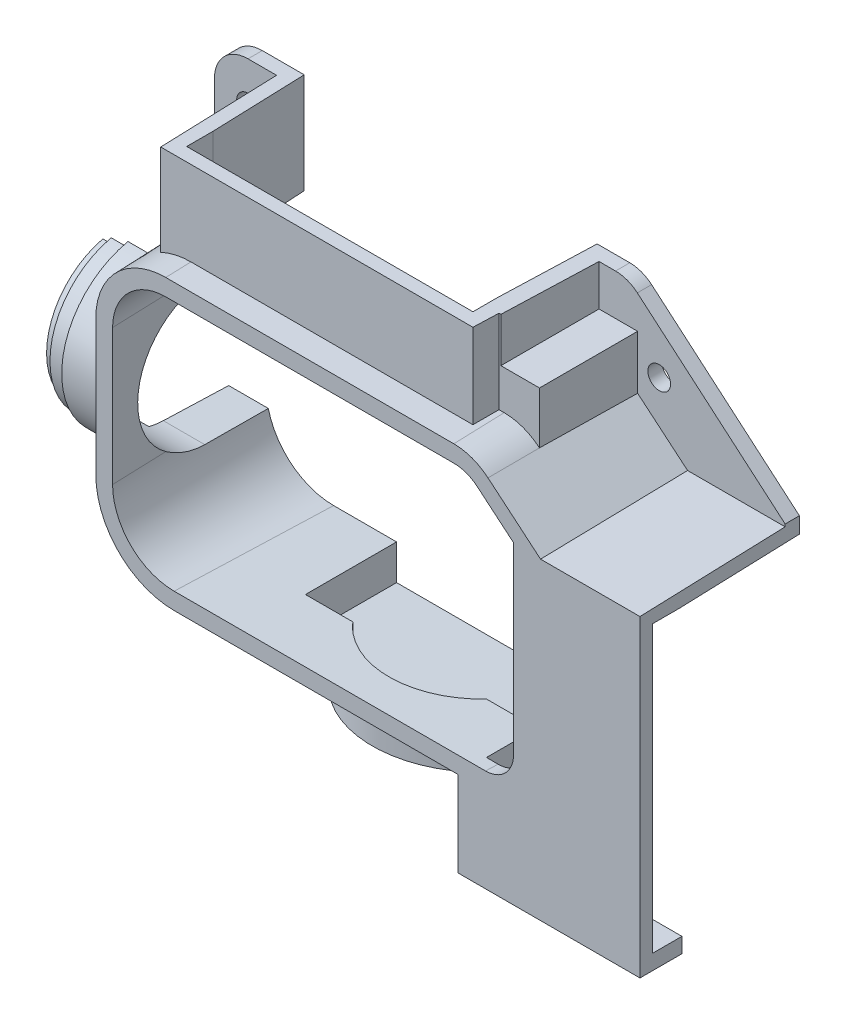
from build123d import *

# Parameters (mm, degrees)
EXTRUDE_1_DEPTH       = 19
CUT_EXTRUDE_1_DEPTH   = 14
CUT_EXTRUDE_1_DRAFT   = -2
CUT_EXTRUDE_2_DEPTH   = 48.910437276
CUT_EXTRUDE_2_DRAFT   = -2
CUT_EXTRUDE_START     = -24.5
CUT_EXTRUDE_3_DEPTH   = 34
CUT_EXTRUDE_4_DEPTH   = 11.25
CUT_EXTRUDE_4_DRAFT   = -2
SKETCH_8_W            = 34.107141343
SKETCH_8_H            = 8
CUT_EXTRUDE_5_DEPTH   = 3.15
SKETCH_13_OUTSIDE_W   = 88.012
SKETCH_13_OUTSIDE_H   = 74.212
CUT_EXTRUDE_9_DEPTH   = 3
CUT_EXTRUDE_9_DRAFT   = -2
CUT_EXTRUDE_10_DEPTH  = 3
CUT_EXTRUDE_10_DRAFT  = -2
CUT_EXTRUDE_11_DEPTH  = 11.3
CUT_EXTRUDE_11_DRAFT  = -2
CUT_EXTRUDE_12_DEPTH  = 3
CUT_EXTRUDE_12_DRAFT  = -2
CUT_EXTRUDE_14_DEPTH  = 11.3
CUT_EXTRUDE_14_DRAFT  = -2
SKETCH_11_R           = 9.7
CUT_EXTRUDE_7_DEPTH   = 39.1
EXTRUDE_START         = -7.432804617
EXTRUDE_4_DEPTH       = 16.504188194
EXTRUDE_START_2       = -20.546029997
EXTRUDE_4_2_DEPTH     = 6.138888654
EXTRUDE_START_3       = -14.8
EXTRUDE_4_3_DEPTH     = 0.462628259
EXTRUDE_START_4       = -14.407141343
EXTRUDE_4_4_DEPTH     = 0.099524193
EXTRUDE_START_5       = -21
EXTRUDE_4_5_OUTLINE_W = 22
EXTRUDE_4_5_OUTLINE_H = 9
EXTRUDE_4_5_DEPTH     = 0.67588307
EXTRUDE_START_6       = -14.127893803
EXTRUDE_4_6_OUTLINE_W = 22
EXTRUDE_4_6_OUTLINE_H = 9
EXTRUDE_4_6_DEPTH     = 1.127893803
CUT_EXTRUDE_START_2   = -0.9
SKETCH_12_R           = 10.5
CUT_EXTRUDE_8_DEPTH   = 38
CUT_EXTRUDE_6_DEPTH   = 48.910437276
EXTRUDE_START_7       = -30
EXTRUDE_2_DEPTH       = 4
CUT_EXTRUDE_START_3   = -5.5
SKETCH_25_W           = 16
SKETCH_25_H           = 30
CUT_EXTRUDE_17_DEPTH  = 5.5
FILLET_1_R            = 4
SKETCH_26_R           = 1.35
CUT_EXTRUDE_18_DEPTH  = 52.958252509
CUT_EXTRUDE_19_REACH  = 65.467
SKETCH_28_R           = 9.7


with BuildPart() as part:
    # 草图1 → 凸台-拉伸1 (new body)
    with BuildSketch(Plane.XY):
        Polygon((34, 11.9), (15.266406942, 27.9), (-34, 27.9), (-34, -18.9369252), (10, -26.3), (34, -26.3), align=None)
    extrude(amount=-EXTRUDE_1_DEPTH)


with BuildPart() as cut_extrude_1_tool:
    # 草图2 → 切除-拉伸1 (with draft: the straight prism first)
    with BuildSketch(Plane(origin=(0, 0, -19), x_dir=(-1, 0, 0), z_dir=(0, 0, -1))):
        Polygon((-34, 10), (-37.6, 10), (-37.6, -30), (-13.6, -30), (-13.6, -26.3), (-13.6, 10), align=None)
    extrude(amount=-CUT_EXTRUDE_1_DEPTH)
    # 切除-拉伸1: the draft: its side faces are tilted about the plane it starts from
    cut_extrude_1_sides = [cut_extrude_1_tool.faces().sort_by_distance(p)[0] for p in [
        (25.6, 10, -12),
        (25.6, -30, -12),
        (13.6, -10, -12),
        (37.6, -10, -12),
    ]]
    draft(cut_extrude_1_sides, Plane(origin=(0, 0, -19), x_dir=(-1, 0, 0), z_dir=(0, 0, -1)), CUT_EXTRUDE_1_DRAFT)


with BuildPart() as part_1:
    add(part.part)

    # 切除-拉伸1: cut by cut_extrude_1_tool
    add(cut_extrude_1_tool.part, mode=Mode.SUBTRACT)


with BuildPart() as cut_extrude_2_tool:
    # 草图3 → 切除-拉伸2 (with draft: the straight prism first)
    with BuildSketch(Plane(origin=(0, 0, -19), x_dir=(-1, 0, 0), z_dir=(0, 0, -1))):
        with BuildLine():
            Line((-19.6, 11.4), (-19.6, -10.8))
            ThreePointArc((-19.6, -10.8), (-18.428427125, -13.628427125), (-15.6, -14.8))
            Line((-15.6, -14.8), (21.5, -14.8))
            ThreePointArc((21.5, -14.8), (27.156854249, -12.456854249), (29.5, -6.8))
            Line((29.5, -6.8), (29.5, 9.4))
            ThreePointArc((29.5, 9.4), (27.449747468, 14.349747468), (22.5, 16.4))
            Line((22.5, 16.4), (-11.821380866, 16.4))
            ThreePointArc((-11.821380866, 16.4), (-13.531481582, 16.098463104), (-15.035318914, 15.230222216))
            Line((-15.035318914, 15.230222216), (-19.6, 11.4))
        make_face()
    extrude(amount=-CUT_EXTRUDE_2_DEPTH)
    # 切除-拉伸2: the draft: its side faces are tilted about the plane it starts from
    cut_extrude_2_sides = [cut_extrude_2_tool.faces().sort_by_distance(p)[0] for p in [
        (19.6, 0.3, 5.455218638),
        (18.428427125, -13.628427125, 5.455218638),
        (-2.95, -14.8, 5.455218638),
        (-27.156854249, -12.456854249, 5.455218638),
        (-29.5, 1.3, 5.455218638),
        (-27.449747468, 14.349747468, 5.455218638),
        (-5.339309567, 16.4, 5.455218638),
        (13.531481582, 16.098463104, 5.455218638),
        (17.317659457, 13.315111108, 5.455218638),
    ]]
    draft(cut_extrude_2_sides, Plane(origin=(0, 0, -19), x_dir=(-1, 0, 0), z_dir=(0, 0, -1)), CUT_EXTRUDE_2_DRAFT)


with BuildPart() as part_2:
    add(part_1.part)

    # 切除-拉伸2: cut by cut_extrude_2_tool
    add(cut_extrude_2_tool.part, mode=Mode.SUBTRACT)

    # 切除-拉伸3: read off the stored shape, not the designer's step
    # 切除-拉伸3 outline → 切除-拉伸3 (cut)
    with BuildSketch(Plane(origin=(0, 0, 0), x_dir=(1, 0, 0), z_dir=(0, 1, 0)).offset(CUT_EXTRUDE_START)):
        Polygon((14.088890773, 5), (14.211113466, 1.5), (34, 1.5), (34, 5), align=None)
    extrude(amount=CUT_EXTRUDE_3_DEPTH, mode=Mode.SUBTRACT)


with BuildPart() as cut_extrude_4_tool:
    # 草图5 → 切除-拉伸4 (with draft: the straight prism first)
    with BuildSketch(Plane(origin=(0, 0, -19), x_dir=(-1, 0, 0), z_dir=(0, 0, -1))):
        Polygon((-9.9, 27.9), (-9.9, 21.3), (-14.5, 21.3), (-14.5, -19), (14, -19), (14, 5), (25, 5), (25, 27.9), (25, 32.9), (-9.9, 32.9), align=None)
    extrude(amount=-CUT_EXTRUDE_4_DEPTH)
    # 切除-拉伸4: the draft: its side faces are tilted about the plane it starts from
    cut_extrude_4_sides = [cut_extrude_4_tool.faces().sort_by_distance(p)[0] for p in [
        (9.9, 27.1, -13.375),
        (-25, 18.95, -13.375),
        (-19.5, 5, -13.375),
        (-14, -7, -13.375),
        (0.25, -19, -13.375),
        (14.5, 1.15, -13.375),
        (-7.55, 32.9, -13.375),
        (12.2, 21.3, -13.375),
    ]]
    draft(cut_extrude_4_sides, Plane(origin=(0, 0, -19), x_dir=(-1, 0, 0), z_dir=(0, 0, -1)), CUT_EXTRUDE_4_DRAFT)


with BuildPart() as part_3:
    add(part_2.part)

    # 切除-拉伸4: cut by cut_extrude_4_tool
    add(cut_extrude_4_tool.part, mode=Mode.SUBTRACT)

    # 草图8 → 切除-拉伸5 (cut)
    with BuildSketch(Plane(origin=(0, 0, -7.75), x_dir=(-1, 0, 0), z_dir=(0, 0, -1))):
        with Locations((7.553570672, 24.9)):
            Rectangle(SKETCH_8_W, SKETCH_8_H)
    extrude(amount=-CUT_EXTRUDE_5_DEPTH, mode=Mode.SUBTRACT)


with BuildPart() as cut_extrude_9_tool:
    # 草图13 outside → 切除-拉伸9 (with draft: the straight prism first)
    with BuildSketch(Plane.XY):
        with Locations((0, 0.8)):
            Rectangle(SKETCH_13_OUTSIDE_W, SKETCH_13_OUTSIDE_H)
        with BuildLine():
            Line((20.93650538, 12.023222694), (15.894408012, 16.254044735))
            ThreePointArc((15.894408012, 16.254044735), (13.988593344, 17.354367347), (11.821380866, 17.73650538))
            Line((11.821380866, 17.73650538), (-22.5, 17.73650538))
            ThreePointArc((-22.5, 17.73650538), (-28.394799485, 15.294799485), (-30.83650538, 9.4))
            Line((-30.83650538, 9.4), (-30.83650538, -6.8))
            ThreePointArc((-30.83650538, -6.8), (-28.101906267, -13.401906267), (-21.5, -16.13650538))
            Line((-21.5, -16.13650538), (12.3, -16.13650538))
            Line((12.3, -16.13650538), (12.3, -29.43650538))
            Line((12.3, -29.43650538), (35.3, -29.43650538))
            Line((35.3, -29.43650538), (35.3, 11))
            Line((35.3, 11), (22.155934701, 11))
            Line((22.155934701, 11), (20.93650538, 12.023222694))
        make_face(mode=Mode.SUBTRACT)
    extrude(amount=-CUT_EXTRUDE_9_DEPTH)
    # 切除-拉伸9: the draft: its side faces are tilted about the plane it starts from
    cut_extrude_9_sides = [cut_extrude_9_tool.faces().sort_by_distance(p)[0] for p in [
        (0, -36.306, -1.5),
        (19.025171357, 13.627022367, -1.5),
        (13.988593344, 17.354367347, -1.5),
        (-5.339309567, 17.73650538, -1.5),
        (-28.394799485, 15.294799485, -1.5),
        (-30.83650538, 1.3, -1.5),
        (-28.101906267, -13.401906267, -1.5),
        (-4.6, -16.13650538, -1.5),
        (12.3, -22.78650538, -1.5),
        (23.8, -29.43650538, -1.5),
        (35.3, -9.21825269, -1.5),
        (28.72796735, 11, -1.5),
        (0, 37.906, -1.5),
        (44.006, 0.8, -1.5),
        (-44.006, 0.8, -1.5),
    ]]
    draft(cut_extrude_9_sides, Plane.XY, CUT_EXTRUDE_9_DRAFT)


with BuildPart() as part_4:
    add(part_3.part)

    # 切除-拉伸9: cut by cut_extrude_9_tool
    add(cut_extrude_9_tool.part, mode=Mode.SUBTRACT)


with BuildPart() as cut_extrude_10_tool:
    # 切除-拉伸10: read off the stored shape, not the designer's step
    # 切除-拉伸10 outline → 切除-拉伸10 (with draft: the straight prism first)
    with BuildSketch(Plane.XY.offset(-6)):
        with BuildLine():
            Line((11.204762308, 27.9), (11.204762308, 17.946029997))
            Line((11.204762308, 17.946029997), (11.821380866, 17.946029997))
            ThreePointArc((11.821380866, 17.946029997), (14.060254983, 17.551256083), (16.02908784, 16.414549903))
            Line((16.02908784, 16.414549903), (22.232195425, 11.209524617))
            Line((22.232195425, 11.209524617), (34, 11.209524617))
            Line((34, 11.209524617), (34, 11.9))
            Line((34, 11.9), (15.266406942, 27.9))
            Line((15.266406942, 27.9), (11.204762308, 27.9))
        make_face()
    extrude(amount=CUT_EXTRUDE_10_DEPTH)
    # 切除-拉伸10: the draft: its side faces are tilted about the plane it starts from
    cut_extrude_10_sides = [cut_extrude_10_tool.faces().sort_by_distance(p)[0] for p in [
        (11.204762308, 22.923014999, -4.5),
        (11.513071587, 17.946029997, -4.5),
        (14.060254983, 17.551256083, -4.5),
        (19.130641632, 13.81203726, -4.5),
        (28.116097713, 11.209524617, -4.5),
        (34, 11.554762309, -4.5),
        (24.633203471, 19.9, -4.5),
        (13.235584625, 27.9, -4.5),
    ]]
    draft(cut_extrude_10_sides, Plane.XY.offset(-6), CUT_EXTRUDE_10_DRAFT)


with BuildPart() as part_5:
    add(part_4.part)

    # 切除-拉伸10: cut by cut_extrude_10_tool
    add(cut_extrude_10_tool.part, mode=Mode.SUBTRACT)


with BuildPart() as cut_extrude_11_tool:
    # 草图16 → 切除-拉伸11 (with draft: the straight prism first)
    with BuildSketch(Plane.XY.offset(-6)):
        Polygon((11.42908784, 27.683058999), (11.42908784, 22.6), (16.02908784, 22.6), (16.02908784, 16.414549903), (22.232195425, 11.209524617), (34.344991098, 11.209524617), (39.42908784, 11.209524617), (39.42908784, 31.209524617), (11.42908784, 31.209524617), align=None)
    extrude(amount=-CUT_EXTRUDE_11_DEPTH)
    # 切除-拉伸11: the draft: its side faces are tilted about the plane it starts from
    cut_extrude_11_sides = [cut_extrude_11_tool.faces().sort_by_distance(p)[0] for p in [
        (11.42908784, 26.904762308, -11.65),
        (39.42908784, 21.209524617, -11.65),
        (30.830641632, 11.209524617, -11.65),
        (19.130641632, 13.81203726, -11.65),
        (16.02908784, 19.507274952, -11.65),
        (25.42908784, 31.209524617, -11.65),
        (13.72908784, 22.6, -11.65),
    ]]
    draft(cut_extrude_11_sides, Plane.XY.offset(-6), CUT_EXTRUDE_11_DRAFT)


with BuildPart() as part_6:
    add(part_5.part)

    # 切除-拉伸11: cut by cut_extrude_11_tool
    add(cut_extrude_11_tool.part, mode=Mode.SUBTRACT)


with BuildPart() as cut_extrude_12_tool:
    # 切除-拉伸12: read off the stored shape, not the designer's step
    # 切除-拉伸12 outline → 切除-拉伸12 (with draft: the straight prism first)
    with BuildSketch(Plane.XY.offset(-6)):
        with BuildLine():
            Line((-34, 27.9), (-34, -18.9369252))
            Line((-34, -18.9369252), (10, -26.3))
            Line((10, -26.3), (12.090475383, -26.3))
            Line((12.090475383, -26.3), (12.090475383, -16.346029997))
            Line((12.090475383, -16.346029997), (-21.5, -16.346029997))
            ThreePointArc((-21.5, -16.346029997), (-28.250062544, -13.550062544), (-31.046029997, -6.8))
            Line((-31.046029997, -6.8), (-31.046029997, 9.4))
            ThreePointArc((-31.046029997, 9.4), (-29.735179283, 13.948275436), (-26.204762308, 17.101257361))
            Line((-26.204762308, 17.101257361), (-26.204762308, 27.9))
            Line((-26.204762308, 27.9), (-34, 27.9))
        make_face()
    extrude(amount=CUT_EXTRUDE_12_DEPTH)
    # 切除-拉伸12: the draft: its side faces are tilted about the plane it starts from
    cut_extrude_12_sides = [cut_extrude_12_tool.faces().sort_by_distance(p)[0] for p in [
        (-34, 4.4815374, -4.5),
        (-12, -22.6184626, -4.5),
        (11.045237692, -26.3, -4.5),
        (12.090475383, -21.323014998, -4.5),
        (-4.704762308, -16.346029997, -4.5),
        (-28.250062544, -13.550062544, -4.5),
        (-31.046029997, 1.3, -4.5),
        (-29.735179283, 13.948275436, -4.5),
        (-26.204762308, 22.500628681, -4.5),
        (-30.102381154, 27.9, -4.5),
    ]]
    draft(cut_extrude_12_sides, Plane.XY.offset(-6), CUT_EXTRUDE_12_DRAFT)


with BuildPart() as part_7:
    add(part_6.part)

    # 切除-拉伸12: cut by cut_extrude_12_tool
    add(cut_extrude_12_tool.part, mode=Mode.SUBTRACT)


with BuildPart() as cut_extrude_14_tool:
    # 切除-拉伸14: read off the stored shape, not the designer's step
    # 切除-拉伸14 outline → 切除-拉伸14 (with draft: the straight prism first)
    with BuildSketch(Plane.XY.offset(-17.3)):
        with BuildLine():
            Line((-34, 27.9), (-34, -18.9369252))
            Line((-34, -18.9369252), (10, -26.3))
            Line((10, -26.3), (11.695870688, -26.3))
            Line((11.695870688, -26.3), (11.695870688, -20.940634692))
            Line((11.695870688, -20.940634692), (-16.304129312, -20.940634692))
            Line((-16.304129312, -20.940634692), (-16.304129312, -16.740634692))
            Line((-16.304129312, -16.740634692), (-21.5, -16.740634692))
            ThreePointArc((-21.5, -16.740634692), (-28.5290902, -13.8290902), (-31.440634692, -6.8))
            Line((-31.440634692, -6.8), (-31.440634692, 9.4))
            ThreePointArc((-31.440634692, 9.4), (-30.134981714, 14.052096616), (-26.599367004, 17.345447682))
            Line((-26.599367004, 17.345447682), (-26.599367004, 27.9))
            Line((-26.599367004, 27.9), (-34, 27.9))
        make_face()
    extrude(amount=CUT_EXTRUDE_14_DEPTH)
    # 切除-拉伸14: the draft: its side faces are tilted about the plane it starts from
    cut_extrude_14_sides = [cut_extrude_14_tool.faces().sort_by_distance(p)[0] for p in [
        (-30.134981714, 14.052096616, -11.65),
        (-26.599367004, 22.622723841, -11.65),
        (-30.299683502, 27.9, -11.65),
        (-34, 4.4815374, -11.65),
        (-12, -22.6184626, -11.65),
        (10.847935344, -26.3, -11.65),
        (11.695870688, -23.620317346, -11.65),
        (-2.304129312, -20.940634692, -11.65),
        (-16.304129312, -18.840634692, -11.65),
        (-18.902064656, -16.740634692, -11.65),
        (-28.5290902, -13.8290902, -11.65),
        (-31.440634692, 1.3, -11.65),
    ]]
    draft(cut_extrude_14_sides, Plane.XY.offset(-17.3), CUT_EXTRUDE_14_DRAFT)


with BuildPart() as part_8:
    add(part_7.part)

    # 切除-拉伸14: cut by cut_extrude_14_tool
    add(cut_extrude_14_tool.part, mode=Mode.SUBTRACT)

    # 草图11 → 切除-拉伸7 (cut)
    with BuildSketch(Plane(origin=(0, 20.9, 0), x_dir=(1, 0, 0), z_dir=(0, 1, 0))):
        with Locations((0, 14.6)):
            Circle(SKETCH_11_R)
    extrude(amount=-CUT_EXTRUDE_7_DEPTH, mode=Mode.SUBTRACT)

    # 凸台-拉伸4: read off the stored shape, not the designer's step
    # 凸台-拉伸4 outline → 凸台-拉伸4 (add)
    with BuildSketch(Plane.YZ.offset(EXTRUDE_START)):
        Polygon((-18.2, -7.75), (-16.407141343, -7.75), (-16.346029997, -6), (-18.2, -6), align=None)
    extrude(amount=EXTRUDE_4_DEPTH)

    # Extrude 4 2 outline → Extrude 4 2 (add)
    with BuildSketch(Plane(origin=(0, 0, 0), x_dir=(1, 0, 0), z_dir=(0, 1, 0)).offset(EXTRUDE_START_2)):
        with BuildLine():
            Line((6.867859929, 7.75), (-6.867859929, 7.75))
            ThreePointArc((-6.867859929, 7.75), (-5.744286821, 6.783788071), (-4.486646855, 6))
            Line((-4.486646855, 6), (-9.071383577, 6))
            ThreePointArc((-9.071383577, 6), (0, 2.1), (9.071383577, 6))
            Line((9.071383577, 6), (4.486646855, 6))
            ThreePointArc((4.486646855, 6), (5.744286821, 6.783788071), (6.867859929, 7.75))
        make_face()
    extrude(amount=EXTRUDE_4_2_DEPTH)

    # Extrude 4 3 outline → Extrude 4 3 (add)
    with BuildSketch(Plane(origin=(0, 0, 0), x_dir=(1, 0, 0), z_dir=(0, 1, 0)).offset(EXTRUDE_START_3)):
        with BuildLine():
            Line((6.867859929, 7.75), (-6.867859929, 7.75))
            ThreePointArc((-6.867859929, 7.75), (0, 4.9), (6.867859929, 7.75))
        make_face()
    extrude(amount=EXTRUDE_4_3_DEPTH)

    # Extrude 4 4 outline → Extrude 4 4 (add)
    with BuildSketch(Plane(origin=(0, 0, 0), x_dir=(1, 0, 0), z_dir=(0, 1, 0)).offset(EXTRUDE_START_4)):
        with BuildLine():
            Line((4.486646855, 6), (-4.486646855, 6))
            ThreePointArc((-4.486646855, 6), (0, 4.9), (4.486646855, 6))
        make_face()
    extrude(amount=EXTRUDE_4_4_DEPTH)

    # Extrude 4 5 outline → Extrude 4 5 (cut)
    with BuildSketch(Plane(origin=(0, 0, 0), x_dir=(1, 0, 0), z_dir=(0, 0.9993908270190958, -0.03489949670250099)).offset(EXTRUDE_START_5)):
        with Locations((0, 5.5)):
            Rectangle(EXTRUDE_4_5_OUTLINE_W, EXTRUDE_4_5_OUTLINE_H)
    extrude(amount=EXTRUDE_4_5_DEPTH, mode=Mode.SUBTRACT)

    # Extrude 4 6 outline → Extrude 4 6 (cut)
    with BuildSketch(Plane(origin=(0, 0, 0), x_dir=(1, 0, 0), z_dir=(0, 0.9993908270190958, -0.03489949670250099)).offset(EXTRUDE_START_6)):
        with Locations((0, 5.5)):
            Rectangle(EXTRUDE_4_6_OUTLINE_W, EXTRUDE_4_6_OUTLINE_H)
    extrude(amount=EXTRUDE_4_6_DEPTH, mode=Mode.SUBTRACT)

    # 草图12 → 切除-拉伸8 (cut)
    with BuildSketch(Plane(origin=(0, 20.9, 0), x_dir=(1, 0, 0), z_dir=(0, 1, 0)).offset(CUT_EXTRUDE_START_2)):
        with Locations((0, 14.6)):
            Circle(SKETCH_12_R)
    extrude(amount=-CUT_EXTRUDE_8_DEPTH, mode=Mode.SUBTRACT)

    # 草图10 → 切除-拉伸6 (cut, through all)
    with BuildSketch(Plane(origin=(0, 0, 0), x_dir=(0, 0, -1), z_dir=(1, 0, 0))):
        with BuildLine():
            Line((21.5, 8.754327867), (11.206844228, 8.394882947))
            ThreePointArc((11.206844228, 8.394882947), (3.1, 0), (11.206844228, -8.394882947))
            Line((11.206844228, -8.394882947), (21.5, -8.754327867))
            Line((21.5, -8.754327867), (21.5, 8.754327867))
        make_face()
    extrude(amount=-CUT_EXTRUDE_6_DEPTH, mode=Mode.SUBTRACT)

    # 草图24 → 凸台-拉伸2 (add)
    with BuildSketch(Plane(origin=(0, 0, 0), x_dir=(0, 0, -1), z_dir=(1, 0, 0)).offset(EXTRUDE_START_7)):
        with BuildLine():
            ThreePointArc((11.206844228, -8.394882947), (3.1, 0), (11.206844228, 8.394882947))
            Line((11.206844228, 8.394882947), (19, 8.667025943))
            Line((19, 8.667025943), (19, 10.16794026))
            Line((19, 10.16794026), (11.154494983, 9.893969187))
            ThreePointArc((11.154494983, 9.893969187), (1.6, 0), (11.154494983, -9.893969187))
            Line((11.154494983, -9.893969187), (19, -10.16794026))
            Line((19, -10.16794026), (19, -8.667025943))
            Line((19, -8.667025943), (11.206844228, -8.394882947))
        make_face()
    extrude(amount=-EXTRUDE_2_DEPTH)

    # 草图22 → 旋转1 (revolve)
    with BuildSketch(Plane.XY.offset(-11.5)):
        Polygon((-34, 9.9), (-36.5, 9.9), (-36.5, 9.3), (-38.5, 9.3), (-38.5, 8.7), (-39.5, 8.7), (-39.5, 7.5), (-37.5, 7.5), (-37.5, 8.4), (-36.5, 8.4), (-36.5, 7.5), (-35.5, 7.5), (-35.5, 8.4), (-34, 8.4), align=None)
    revolve(axis=Axis((0, 0, -11.5), (-1, 0, 0)))

    # 草图25 → 切除-拉伸17 (cut)
    with BuildSketch(Plane.ZY.offset(39.5).offset(CUT_EXTRUDE_START_3)):
        with Locations((-17.5, 0)):
            Rectangle(SKETCH_25_W, SKETCH_25_H)
    extrude(amount=CUT_EXTRUDE_17_DEPTH, mode=Mode.SUBTRACT)

    # 圆角1
    fillet_1_edges = [part_8.edges().sort_by_distance(p)[0] for p in [
        (-34, -18.9369252, -18.15),
        (-34, 27.9, -18.15),
        (15.266406942, 27.9, -18.15),
    ]]
    fillet(fillet_1_edges, radius=FILLET_1_R)

    # 草图26 → 切除-拉伸18 (cut, through all)
    with BuildSketch(Plane(origin=(0, 0, -19), x_dir=(-1, 0, 0), z_dir=(0, 0, -1))):
        with Locations((-19, 19.5)):
            Circle(SKETCH_26_R)
        with Locations((30, 23)):
            Circle(SKETCH_26_R)
        with Locations((-9.4, -23)):
            Circle(SKETCH_26_R)
        with Locations((30, -16)):
            Circle(SKETCH_26_R)
    extrude(amount=-CUT_EXTRUDE_18_DEPTH, mode=Mode.SUBTRACT)

    # 切除-拉伸19: up to this plane
    cut_extrude_19_end = Plane(origin=(14.5, -19, -19), z_dir=(0, -0.9993908270190958, 0.03489949670250105))
    # 草图28 → 切除-拉伸19 (cut, up to the surface)
    with BuildSketch(Plane(origin=(0, -18, 0), x_dir=(1, 0, 0), z_dir=(0, 1, 0)), mode=Mode.PRIVATE) as cut_extrude_19_sk1:
        with Locations((0, 14.6)):
            Circle(SKETCH_28_R)
    cut_extrude_19_tool1 = split(extrude(cut_extrude_19_sk1.sketch, amount=-CUT_EXTRUDE_19_REACH, mode=Mode.PRIVATE), bisect_by=cut_extrude_19_end, keep=Keep.BOTH, mode=Mode.PRIVATE)
    add(cut_extrude_19_tool1.solids().sort_by_distance((0, -18, -14.6))[0], mode=Mode.SUBTRACT)


solid = part_8.part
